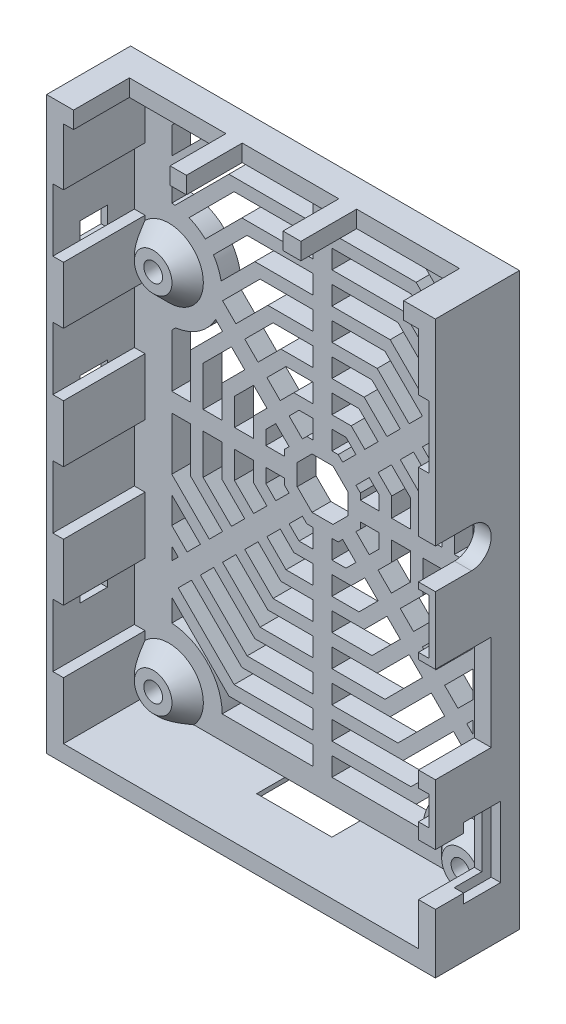
from build123d import *

# Parameters (mm, degrees)
BOSS_EXTRUDE1_DEPTH      = 1.5
BOSS_EXTRUDE1_DEPTH_BACK = 1.5
SKETCH2_W                = 62
SKETCH2_H                = 91
SKETCH2_R                = 1.5
SKETCH3_R                = 3
SKETCH3_R_2              = 1.5
BOSS_EXTRUDE2_DEPTH      = 2.5
SKETCH4_W                = 62
SKETCH4_H                = 91
SKETCH4_W_2              = 56.6
SKETCH4_H_2              = 85.6
BOSS_EXTRUDE3_DEPTH      = 13
CUT_EXTRUDE1_REACH       = 99.223
SKETCH5_W                = 15.4
SKETCH5_H                = 8.9
SKETCH5_W_2              = 16.4
CUT_EXTRUDE2_REACH       = 80.259
SKETCH6_W                = 8.9
SKETCH6_H                = 8.25
SKETCH6_H_2              = 15.25
CUT_EXTRUDE3_DEPTH       = 2
CHAMFER1_SIZE            = 2.5
CUT_EXTRUDE4_REACH       = 96.7
SKETCH8_W                = 12
SKETCH8_H                = 7.5
CHAMFER2_SIZE            = 2
SKETCH12_W               = 5.9
SKETCH12_H               = 11.25
CUT_EXTRUDE7_DEPTH       = 1.5
CHAMFER3_SIZE            = 2.6
CUT_EXTRUDE9_DEPTH       = 3
SKETCH14_W               = 1.7
SKETCH14_H               = 10
SKETCH14_H_2             = 8.725
SKETCH14_H_3             = 4.65
CUT_EXTRUDE10_DEPTH      = 13
CAVITY3_START            = -31
CAVITY3_OUTLINE_W        = 2.690598923
CAVITY3_OUTLINE_H        = 4
CAVITY3_DEPTH            = 1
SKETCH15_W               = 4.4
SKETCH15_H               = 3.090598923
CUT_EXTRUDE11_DEPTH      = 1


# Read off the part's stored shape, not the designer's step: Cavity3
with BuildPart() as part:
    # Sketch2 → Boss-Extrude1 (new, two sides: drawn at the far end of the back side and taken through both)
    with BuildSketch(Plane.XY.offset(-BOSS_EXTRUDE1_DEPTH_BACK)):
        Rectangle(SKETCH2_W, SKETCH2_H)
        with Locations((-24.5, 19)):
            Circle(SKETCH2_R, mode=Mode.SUBTRACT)
        with Locations((-24.5, -39)):
            Circle(SKETCH2_R, mode=Mode.SUBTRACT)
        with Locations((24.5, -39)):
            Circle(SKETCH2_R, mode=Mode.SUBTRACT)
        with Locations((24.5, 19)):
            Circle(SKETCH2_R, mode=Mode.SUBTRACT)
    extrude(amount=BOSS_EXTRUDE1_DEPTH + BOSS_EXTRUDE1_DEPTH_BACK)

    # Sketch3 → Boss-Extrude2 (add)
    # profile 1 of 4: a face of its own
    with BuildSketch(Plane.XY.offset(1.5)):
        with Locations((-24.5, 19)):
            Circle(SKETCH3_R)
        with Locations((-24.5, 19)):
            Circle(SKETCH3_R_2, mode=Mode.SUBTRACT)
    # profile 2 of 4: a face of its own
    with BuildSketch(Plane.XY.offset(1.5)):
        with Locations((24.5, 19)):
            Circle(SKETCH3_R)
        with Locations((24.5, 19)):
            Circle(SKETCH3_R_2, mode=Mode.SUBTRACT)
    # profile 3 of 4: a face of its own
    with BuildSketch(Plane.XY.offset(1.5)):
        with Locations((24.5, -39)):
            Circle(SKETCH3_R)
        with Locations((24.5, -39)):
            Circle(SKETCH3_R_2, mode=Mode.SUBTRACT)
    # profile 4 of 4: a face of its own
    with BuildSketch(Plane.XY.offset(1.5)):
        with Locations((-24.5, -39)):
            Circle(SKETCH3_R)
        with Locations((-24.5, -39)):
            Circle(SKETCH3_R_2, mode=Mode.SUBTRACT)
    extrude(amount=BOSS_EXTRUDE2_DEPTH)

    # Sketch4 → Boss-Extrude3 (add)
    with BuildSketch(Plane.XY.offset(1.5)):
        Rectangle(SKETCH4_W, SKETCH4_H)
        Rectangle(SKETCH4_W_2, SKETCH4_H_2, mode=Mode.SUBTRACT)
    extrude(amount=BOSS_EXTRUDE3_DEPTH)

    # Sketch5 → Cut-Extrude1 (cut, up to next)
    with BuildSketch(Plane(origin=(0, 45.5, 0), x_dir=(1, 0, 0), z_dir=(0, 1, 0)), mode=Mode.PRIVATE) as cut_extrude1_sk1:
        with Locations((-19, -10.05)):
            Rectangle(SKETCH5_W, SKETCH5_H)
    cut_extrude1_tool1 = extrude(cut_extrude1_sk1.sketch, amount=-CUT_EXTRUDE1_REACH, mode=Mode.PRIVATE) & part.part
    # Sketch5 → Cut-Extrude1 (cut, up to next)
    with BuildSketch(Plane(origin=(0, 45.5, 0), x_dir=(1, 0, 0), z_dir=(0, 1, 0)), mode=Mode.PRIVATE) as cut_extrude1_sk2:
        with Locations((-1, -10.05)):
            Rectangle(SKETCH5_W, SKETCH5_H)
    cut_extrude1_tool2 = extrude(cut_extrude1_sk2.sketch, amount=-CUT_EXTRUDE1_REACH, mode=Mode.PRIVATE) & part.part
    # Sketch5 → Cut-Extrude1 (cut, up to next)
    with BuildSketch(Plane(origin=(0, 45.5, 0), x_dir=(1, 0, 0), z_dir=(0, 1, 0)), mode=Mode.PRIVATE) as cut_extrude1_sk3:
        with Locations((17.75, -10.05)):
            Rectangle(SKETCH5_W_2, SKETCH5_H)
    cut_extrude1_tool3 = extrude(cut_extrude1_sk3.sketch, amount=-CUT_EXTRUDE1_REACH, mode=Mode.PRIVATE) & part.part
    add(cut_extrude1_tool1.solids().sort_by_distance((-19, 45.5, 10.05))[0], mode=Mode.SUBTRACT)
    add(cut_extrude1_tool2.solids().sort_by_distance((-1, 45.5, 10.05))[0], mode=Mode.SUBTRACT)
    add(cut_extrude1_tool3.solids().sort_by_distance((17.75, 45.5, 10.05))[0], mode=Mode.SUBTRACT)

    # Sketch6 → Cut-Extrude2 (cut, up to next)
    with BuildSketch(Plane(origin=(31, 0, 0), x_dir=(0, 0, -1), z_dir=(1, 0, 0)), mode=Mode.PRIVATE) as cut_extrude2_sk1:
        with BuildLine():
            Line((-8.75, 14.15), (-14.5, 14.15))
            Line((-14.5, 14.15), (-14.5, 7.85))
            Line((-14.5, 7.85), (-8.75, 7.85))
            ThreePointArc((-8.75, 7.85), (-5.6, 11), (-8.75, 14.15))
        make_face()
    cut_extrude2_tool1 = extrude(cut_extrude2_sk1.sketch, amount=-CUT_EXTRUDE2_REACH, mode=Mode.PRIVATE) & part.part
    # Sketch6 → Cut-Extrude2 (cut, up to next)
    with BuildSketch(Plane(origin=(31, 0, 0), x_dir=(0, 0, -1), z_dir=(1, 0, 0)), mode=Mode.PRIVATE) as cut_extrude2_sk2:
        with Locations((-10.05, -31.9)):
            Rectangle(SKETCH6_W, SKETCH6_H)
    cut_extrude2_tool2 = extrude(cut_extrude2_sk2.sketch, amount=-CUT_EXTRUDE2_REACH, mode=Mode.PRIVATE) & part.part
    # Sketch6 → Cut-Extrude2 (cut, up to next)
    with BuildSketch(Plane(origin=(31, 0, 0), x_dir=(0, 0, -1), z_dir=(1, 0, 0)), mode=Mode.PRIVATE) as cut_extrude2_sk3:
        with Locations((-10.05, -10.5)):
            Rectangle(SKETCH6_W, SKETCH6_H_2)
    cut_extrude2_tool3 = extrude(cut_extrude2_sk3.sketch, amount=-CUT_EXTRUDE2_REACH, mode=Mode.PRIVATE) & part.part
    add(cut_extrude2_tool1.solids().sort_by_distance((31, 11, 10.357945))[0], mode=Mode.SUBTRACT)
    add(cut_extrude2_tool2.solids().sort_by_distance((31, -31.9, 10.05))[0], mode=Mode.SUBTRACT)
    add(cut_extrude2_tool3.solids().sort_by_distance((31, -10.5, 10.05))[0], mode=Mode.SUBTRACT)

    # Sketch7 → Cut-Extrude3 (cut)
    with BuildSketch(Plane(origin=(0, 0, -1.5), x_dir=(-1, 0, 0), z_dir=(0, 0, -1))):
        Polygon((-21.266838493, 19), (-22.883419246, 21.8), (-26.116580754, 21.8), (-27.733161507, 19), (-26.116580754, 16.2), (-22.883419246, 16.2), align=None)
        Polygon((27.733161507, 19), (26.116580754, 21.8), (22.883419246, 21.8), (21.266838493, 19), (22.883419246, 16.2), (26.116580754, 16.2), align=None)
        Polygon((27.733161507, -39), (26.116580754, -36.2), (22.883419246, -36.2), (21.266838493, -39), (22.883419246, -41.8), (26.116580754, -41.8), align=None)
        Polygon((-21.266838493, -39), (-22.883419246, -36.2), (-26.116580754, -36.2), (-27.733161507, -39), (-26.116580754, -41.8), (-22.883419246, -41.8), align=None)
    extrude(amount=-CUT_EXTRUDE3_DEPTH, mode=Mode.SUBTRACT)

    # Chamfer1
    # the kernel refuses this chamfer: 2.5 mm, written as the material it adds along each edge
    with BuildSketch(Plane(origin=(-24.5, 19, 1.5), x_dir=(1, 0, 0), z_dir=(0, -1, 0))) as chamfer1_piece_1_section:
        Polygon((3 + CHAMFER1_SIZE, 0), (3, CHAMFER1_SIZE), (3, 0), align=None)
    chamfer1_piece_1 = revolve(axis=Axis((-24.5, 19, 1.5), (0, 0, 1)), mode=Mode.PRIVATE)
    chamfer1_piece_1 = split(chamfer1_piece_1, bisect_by=Plane(origin=(-28.754569267, 19, 4), z_dir=(0, 0, -1)), keep=Keep.TOP, mode=Mode.PRIVATE)
    add(chamfer1_piece_1)
    with BuildSketch(Plane(origin=(24.5, 19, 1.5), x_dir=(1, 0, 0), z_dir=(0, -1, 0))) as chamfer1_piece_2_section:
        Polygon((3 + CHAMFER1_SIZE, 0), (3, CHAMFER1_SIZE), (3, 0), align=None)
    chamfer1_piece_2 = revolve(axis=Axis((24.5, 19, 1.5), (0, 0, 1)), mode=Mode.PRIVATE)
    chamfer1_piece_2 = split(chamfer1_piece_2, bisect_by=Plane(origin=(20.245430733, 19, 4), z_dir=(0, 0, -1)), keep=Keep.TOP, mode=Mode.PRIVATE)
    add(chamfer1_piece_2)
    with BuildSketch(Plane(origin=(24.5, -39, 1.5), x_dir=(1, 0, 0), z_dir=(0, -1, 0))) as chamfer1_piece_3_section:
        Polygon((3 + CHAMFER1_SIZE, 0), (3, CHAMFER1_SIZE), (3, 0), align=None)
    chamfer1_piece_3 = revolve(axis=Axis((24.5, -39, 1.5), (0, 0, 1)), mode=Mode.PRIVATE)
    chamfer1_piece_3 = split(chamfer1_piece_3, bisect_by=Plane(origin=(20.245430733, -39, 4), z_dir=(0, 0, -1)), keep=Keep.TOP, mode=Mode.PRIVATE)
    add(chamfer1_piece_3)
    with BuildSketch(Plane(origin=(-24.5, -39, 1.5), x_dir=(1, 0, 0), z_dir=(0, -1, 0))) as chamfer1_piece_4_section:
        Polygon((3 + CHAMFER1_SIZE, 0), (3, CHAMFER1_SIZE), (3, 0), align=None)
    chamfer1_piece_4 = revolve(axis=Axis((-24.5, -39, 1.5), (0, 0, 1)), mode=Mode.PRIVATE)
    chamfer1_piece_4 = split(chamfer1_piece_4, bisect_by=Plane(origin=(-28.754569267, -39, 4), z_dir=(0, 0, -1)), keep=Keep.TOP, mode=Mode.PRIVATE)
    add(chamfer1_piece_4)

    # Sketch8 → Cut-Extrude4 (cut, up to next)
    with BuildSketch(Plane(origin=(0, -42.8, 0), x_dir=(1, 0, 0), z_dir=(0, 1, 0)), mode=Mode.PRIVATE) as cut_extrude4_sk1:
        with Locations((0, -2.25)):
            Rectangle(SKETCH8_W, SKETCH8_H)
    cut_extrude4_tool1 = extrude(cut_extrude4_sk1.sketch, amount=-CUT_EXTRUDE4_REACH, mode=Mode.PRIVATE) & part.part
    add(cut_extrude4_tool1.solids().sort_by_distance((0, -42.8, 2.25))[0], mode=Mode.SUBTRACT)

    # Chamfer2
    chamfer2_edges = [part.edges().sort_by_distance(p)[0] for p in [
        (-6, -45.5, 2.25),
        (6, -45.5, 2.25),
        (0, -45.5, 6),
    ]]
    chamfer(chamfer2_edges, length=CHAMFER2_SIZE)

    # Sketch12 → Cut-Extrude7 (cut)
    with BuildSketch(Plane(origin=(31, 0, 0), x_dir=(0, 0, -1), z_dir=(1, 0, 0))):
        with Locations((-7.05, -31.9)):
            Rectangle(SKETCH12_W, SKETCH12_H)
    extrude(amount=-CUT_EXTRUDE7_DEPTH, mode=Mode.SUBTRACT)

    # Chamfer3
    chamfer3_edges = [part.edges().sort_by_distance(p)[0] for p in [
        (19.5, -45.5, -1.5),
        (31, 0, -1.5),
        (0, 45.5, -1.5),
        (-19.5, -45.5, -1.5),
        (-31, 0, -1.5),
    ]]
    chamfer(chamfer3_edges, length=CHAMFER3_SIZE)

    # Sketch13 → Cut-Extrude9 (cut)
    with BuildSketch(Plane.XY.offset(1.5)):
        with BuildLine():
            Line((-16.169047558, 39.035533906), (-1.5, 39.035533906))
            Line((-1.5, 39.035533906), (-1.5, 36.035533906))
            Line((-1.5, 36.035533906), (-14.926406871, 36.035533906))
            Line((-14.926406871, 36.035533906), (-23.518767087, 27.443173691))
            ThreePointArc((-23.518767087, 27.443173691), (-23.776813855, 27.469179523), (-24.035533906, 27.487300587))
            Line((-24.035533906, 27.487300587), (-24.035533906, 31.169047558))
            Line((-24.035533906, 31.169047558), (-16.169047558, 39.035533906))
        make_face()
        Polygon((-5.813708499, 14.035533906), (-1.5, 14.035533906), (-1.5, 11.035533906), (-4.571067812, 11.035533906), (-6.742640687, 8.863961031), (-8.863961031, 10.985281374), align=None)
        Polygon((-7.884776311, 19.035533906), (-1.5, 19.035533906), (-1.5, 16.035533906), (-6.642135624, 16.035533906), (-10.278174593, 12.399494937), (-12.399494937, 14.52081528), align=None)
        Polygon((-9.955844123, 24.035533906), (-1.5, 24.035533906), (-1.5, 21.035533906), (-8.713203436, 21.035533906), (-13.813708499, 15.935028843), (-15.935028843, 18.056349186), align=None)
        with BuildLine():
            Line((-12.026911935, 29.035533906), (-1.5, 29.035533906))
            Line((-1.5, 29.035533906), (-1.5, 26.035533906))
            Line((-1.5, 26.035533906), (-10.784271247, 26.035533906))
            Line((-10.784271247, 26.035533906), (-16.163028634, 20.65677652))
            ThreePointArc((-16.163028634, 20.65677652), (-16.634038342, 22.221280366), (-17.395682807, 23.666763034))
            Line((-17.395682807, 23.666763034), (-12.026911935, 29.035533906))
        make_face()
        Polygon((-3.742640687, 9.035533906), (-1.5, 9.035533906), (-1.5, 6.035533906), (-2.5, 6.035533906), (-3.207106781, 5.328427125), (-5.328427125, 7.449747468), align=None)
        with BuildLine():
            Line((-14.097979746, 34.035533906), (-1.5, 34.035533906))
            Line((-1.5, 34.035533906), (-1.5, 31.035533906))
            Line((-1.5, 31.035533906), (-12.855339059, 31.035533906))
            Line((-12.855339059, 31.035533906), (-18.688207123, 25.202665842))
            ThreePointArc((-18.688207123, 25.202665842), (-19.903933414, 26.150256774), (-21.270799938, 26.862713715))
            Line((-21.270799938, 26.862713715), (-14.097979746, 34.035533906))
        make_face()
        Polygon((-23.24011537, 39.035533906), (-18.997474683, 39.035533906), (-24.035533906, 33.997474683), (-24.035533906, 38.24011537), align=None)
        Polygon((24.035533906, -9.955844123), (24.035533906, -1.5), (21.035533906, -1.5), (21.035533906, -8.713203436), (15.935028843, -13.813708499), (18.056349186, -15.935028843), align=None)
        Polygon((24.035533906, -21.914213562), (24.035533906, -19.855339059), (23.006096654, -20.884776311), align=None)
        Polygon((-24.035533906, -9.955844123), (-24.035533906, -1.5), (-21.035533906, -1.5), (-21.035533906, -8.713203436), (-15.935028843, -13.813708499), (-18.056349186, -15.935028843), align=None)
        with BuildLine():
            Line((-24.035533906, 9.955844123), (-24.035533906, 1.5))
            Line((-24.035533906, 1.5), (-21.035533906, 1.5))
            Line((-21.035533906, 1.5), (-21.035533906, 8.713203436))
            Line((-21.035533906, 8.713203436), (-15.935028843, 13.813708499))
            Line((-15.935028843, 13.813708499), (-17.04254688, 14.921226537))
            ThreePointArc((-17.04254688, 14.921226537), (-19.709764655, 11.978344544), (-23.422851922, 10.568526106))
            Line((-23.422851922, 10.568526106), (-24.035533906, 9.955844123))
        make_face()
        Polygon((-24.035533906, -21.914213562), (-24.035533906, -19.855339059), (-23.006096654, -20.884776311), align=None)
        Polygon((24.035533906, -17.026911935), (24.035533906, -12.784271247), (19.470562748, -17.349242405), (21.591883092, -19.470562748), align=None)
        with BuildLine():
            Line((24.035533906, 9.955844123), (24.035533906, 1.5))
            Line((24.035533906, 1.5), (21.035533906, 1.5))
            Line((21.035533906, 1.5), (21.035533906, 8.713203436))
            Line((21.035533906, 8.713203436), (15.935028843, 13.813708499))
            Line((15.935028843, 13.813708499), (17.04254688, 14.921226537))
            ThreePointArc((17.04254688, 14.921226537), (19.709764655, 11.978344544), (23.422851922, 10.568526106))
            Line((23.422851922, 10.568526106), (24.035533906, 9.955844123))
        make_face()
        with BuildLine():
            Line((24.035533906, 31.169047558), (24.035533906, 27.487300587))
            ThreePointArc((24.035533906, 27.487300587), (23.776813855, 27.469179523), (23.518767087, 27.443173691))
            Line((23.518767087, 27.443173691), (14.926406871, 36.035533906))
            Line((14.926406871, 36.035533906), (1.5, 36.035533906))
            Line((1.5, 36.035533906), (1.5, 39.035533906))
            Line((1.5, 39.035533906), (16.169047558, 39.035533906))
            Line((16.169047558, 39.035533906), (24.035533906, 31.169047558))
        make_face()
        Polygon((-24.035533906, -17.026911935), (-24.035533906, -12.784271247), (-19.470562748, -17.349242405), (-21.591883092, -19.470562748), align=None)
        Polygon((4.035533906, -1.671572875), (4.035533906, 1.671572875), (1.671572875, 4.035533906), (-1.671572875, 4.035533906), (-4.035533906, 1.671572875), (-4.035533906, -1.671572875), (-1.671572875, -4.035533906), (1.671572875, -4.035533906), align=None)
        Polygon((23.24011537, 39.035533906), (18.997474683, 39.035533906), (24.035533906, 33.997474683), (24.035533906, 38.24011537), align=None)
        with BuildLine():
            Line((14.097979746, 34.035533906), (1.5, 34.035533906))
            Line((1.5, 34.035533906), (1.5, 31.035533906))
            Line((1.5, 31.035533906), (12.855339059, 31.035533906))
            Line((12.855339059, 31.035533906), (18.688207123, 25.202665842))
            ThreePointArc((18.688207123, 25.202665842), (19.903933414, 26.150256774), (21.270799938, 26.862713715))
            Line((21.270799938, 26.862713715), (14.097979746, 34.035533906))
        make_face()
        with BuildLine():
            Line((12.026911935, 29.035533906), (1.5, 29.035533906))
            Line((1.5, 29.035533906), (1.5, 26.035533906))
            Line((1.5, 26.035533906), (10.784271247, 26.035533906))
            Line((10.784271247, 26.035533906), (16.163028634, 20.65677652))
            ThreePointArc((16.163028634, 20.65677652), (16.634038342, 22.221280366), (17.395682807, 23.666763034))
            Line((17.395682807, 23.666763034), (12.026911935, 29.035533906))
        make_face()
        Polygon((9.955844123, 24.035533906), (1.5, 24.035533906), (1.5, 21.035533906), (8.713203436, 21.035533906), (13.813708499, 15.935028843), (15.935028843, 18.056349186), align=None)
        Polygon((7.884776311, 19.035533906), (1.5, 19.035533906), (1.5, 16.035533906), (6.642135624, 16.035533906), (10.278174593, 12.399494937), (12.399494937, 14.52081528), align=None)
        Polygon((5.813708499, 14.035533906), (1.5, 14.035533906), (1.5, 11.035533906), (4.571067812, 11.035533906), (6.742640687, 8.863961031), (8.863961031, 10.985281374), align=None)
        Polygon((3.742640687, 9.035533906), (1.5, 9.035533906), (1.5, 6.035533906), (2.5, 6.035533906), (3.207106781, 5.328427125), (5.328427125, 7.449747468), align=None)
        Polygon((19.035533906, 7.884776311), (14.52081528, 12.399494937), (12.399494937, 10.278174593), (16.035533906, 6.642135624), (16.035533906, 1.5), (19.035533906, 1.5), align=None)
        Polygon((14.035533906, 5.813708499), (10.985281374, 8.863961031), (8.863961031, 6.742640687), (11.035533906, 4.571067812), (11.035533906, 1.5), (14.035533906, 1.5), align=None)
        Polygon((9.035533906, 3.742640687), (7.449747468, 5.328427125), (5.328427125, 3.207106781), (6.035533906, 2.5), (6.035533906, 1.5), (9.035533906, 1.5), align=None)
        with BuildLine():
            Line((24.035533906, -30.512699413), (24.035533906, -26.926406871))
            Line((24.035533906, -26.926406871), (14.926406871, -36.035533906))
            Line((14.926406871, -36.035533906), (1.5, -36.035533906))
            Line((1.5, -36.035533906), (1.5, -39.035533906))
            Line((1.5, -39.035533906), (16.000074274, -39.035533906))
            ThreePointArc((16.000074274, -39.035533906), (18.315361197, -33.169027279), (24.035533906, -30.512699413))
        make_face()
        Polygon((19.035533906, -7.884776311), (19.035533906, -1.5), (16.035533906, -1.5), (16.035533906, -6.642135624), (12.399494937, -10.278174593), (14.52081528, -12.399494937), align=None)
        Polygon((14.035533906, -5.813708499), (14.035533906, -1.5), (11.035533906, -1.5), (11.035533906, -4.571067812), (8.863961031, -6.742640687), (10.985281374, -8.863961031), align=None)
        Polygon((9.035533906, -3.742640687), (9.035533906, -1.5), (6.035533906, -1.5), (6.035533906, -2.5), (5.328427125, -3.207106781), (7.449747468, -5.328427125), align=None)
        Polygon((14.097979746, -34.035533906), (23.006096654, -25.127416998), (20.884776311, -23.006096654), (12.855339059, -31.035533906), (1.5, -31.035533906), (1.5, -34.035533906), align=None)
        Polygon((12.026911935, -29.035533906), (19.470562748, -21.591883092), (17.349242405, -19.470562748), (10.784271247, -26.035533906), (1.5, -26.035533906), (1.5, -29.035533906), align=None)
        Polygon((9.955844123, -24.035533906), (15.935028843, -18.056349186), (13.813708499, -15.935028843), (8.713203436, -21.035533906), (1.5, -21.035533906), (1.5, -24.035533906), align=None)
        Polygon((7.884776311, -19.035533906), (12.399494937, -14.52081528), (10.278174593, -12.399494937), (6.642135624, -16.035533906), (1.5, -16.035533906), (1.5, -19.035533906), align=None)
        Polygon((5.813708499, -14.035533906), (8.863961031, -10.985281374), (6.742640687, -8.863961031), (4.571067812, -11.035533906), (1.5, -11.035533906), (1.5, -14.035533906), align=None)
        Polygon((3.742640687, -9.035533906), (5.328427125, -7.449747468), (3.207106781, -5.328427125), (2.5, -6.035533906), (1.5, -6.035533906), (1.5, -9.035533906), align=None)
        with BuildLine():
            Line((-16.000074274, -39.035533906), (-1.5, -39.035533906))
            Line((-1.5, -39.035533906), (-1.5, -36.035533906))
            Line((-1.5, -36.035533906), (-14.926406871, -36.035533906))
            Line((-14.926406871, -36.035533906), (-24.035533906, -26.926406871))
            Line((-24.035533906, -26.926406871), (-24.035533906, -30.512699413))
            ThreePointArc((-24.035533906, -30.512699413), (-18.315361197, -33.169027279), (-16.000074274, -39.035533906))
        make_face()
        Polygon((-14.097979746, -34.035533906), (-1.5, -34.035533906), (-1.5, -31.035533906), (-12.855339059, -31.035533906), (-20.884776311, -23.006096654), (-23.006096654, -25.127416998), align=None)
        Polygon((-12.026911935, -29.035533906), (-1.5, -29.035533906), (-1.5, -26.035533906), (-10.784271247, -26.035533906), (-17.349242405, -19.470562748), (-19.470562748, -21.591883092), align=None)
        Polygon((-9.955844123, -24.035533906), (-1.5, -24.035533906), (-1.5, -21.035533906), (-8.713203436, -21.035533906), (-13.813708499, -15.935028843), (-15.935028843, -18.056349186), align=None)
        Polygon((-7.884776311, -19.035533906), (-1.5, -19.035533906), (-1.5, -16.035533906), (-6.642135624, -16.035533906), (-10.278174593, -12.399494937), (-12.399494937, -14.52081528), align=None)
        Polygon((-5.813708499, -14.035533906), (-1.5, -14.035533906), (-1.5, -11.035533906), (-4.571067812, -11.035533906), (-6.742640687, -8.863961031), (-8.863961031, -10.985281374), align=None)
        Polygon((-3.742640687, -9.035533906), (-1.5, -9.035533906), (-1.5, -6.035533906), (-2.5, -6.035533906), (-3.207106781, -5.328427125), (-5.328427125, -7.449747468), align=None)
        Polygon((-19.035533906, -7.884776311), (-14.52081528, -12.399494937), (-12.399494937, -10.278174593), (-16.035533906, -6.642135624), (-16.035533906, -1.5), (-19.035533906, -1.5), align=None)
        Polygon((-14.035533906, -5.813708499), (-10.985281374, -8.863961031), (-8.863961031, -6.742640687), (-11.035533906, -4.571067812), (-11.035533906, -1.5), (-14.035533906, -1.5), align=None)
        Polygon((-9.035533906, -3.742640687), (-7.449747468, -5.328427125), (-5.328427125, -3.207106781), (-6.035533906, -2.5), (-6.035533906, -1.5), (-9.035533906, -1.5), align=None)
        Polygon((-19.035533906, 7.884776311), (-19.035533906, 1.5), (-16.035533906, 1.5), (-16.035533906, 6.642135624), (-12.399494937, 10.278174593), (-14.52081528, 12.399494937), align=None)
        Polygon((-14.035533906, 5.813708499), (-14.035533906, 1.5), (-11.035533906, 1.5), (-11.035533906, 4.571067812), (-8.863961031, 6.742640687), (-10.985281374, 8.863961031), align=None)
        Polygon((-9.035533906, 3.742640687), (-9.035533906, 1.5), (-6.035533906, 1.5), (-6.035533906, 2.5), (-5.328427125, 3.207106781), (-7.449747468, 5.328427125), align=None)
    extrude(amount=-CUT_EXTRUDE9_DEPTH, mode=Mode.SUBTRACT)

    # Sketch14 → Cut-Extrude10 (cut)
    with BuildSketch(Plane.XY.offset(14.5)):
        with Locations((-29.15, 28.68)):
            Rectangle(SKETCH14_W, SKETCH14_H)
        with Locations((-29.15, 9.56)):
            Rectangle(SKETCH14_W, SKETCH14_H)
        with Locations((-29.15, -9.56)):
            Rectangle(SKETCH14_W, SKETCH14_H)
        with Locations((-29.15, -28.68)):
            Rectangle(SKETCH14_W, SKETCH14_H)
        with Locations((29.15, 28.68)):
            Rectangle(SKETCH14_W, SKETCH14_H)
        with Locations((29.15, 2.4875)):
            Rectangle(SKETCH14_W, SKETCH14_H_2)
        with Locations((29.15, -22.95)):
            Rectangle(SKETCH14_W, SKETCH14_H_3)
    extrude(amount=-CUT_EXTRUDE10_DEPTH, mode=Mode.SUBTRACT)

    # Cavity3 outline → Cavity3 (cut)
    with BuildSketch(Plane.YZ.offset(CAVITY3_START)):
        Polygon((4.809401077, 10), (3.464101615, 10), (0, 12), (-3.464101615, 10), (-4.809401077, 10), (-4.809401077, 6), (-3.464101615, 6), (0, 4), (3.464101615, 6), (4.809401077, 6), align=None)
        with Locations((-24.845299462, 8)):
            Rectangle(CAVITY3_OUTLINE_W, CAVITY3_OUTLINE_H)
        with Locations((24.845299462, 8)):
            Rectangle(CAVITY3_OUTLINE_W, CAVITY3_OUTLINE_H)
        Polygon((-39, 4), (-35.535898385, 6), (-35.535898385, 10), (-39, 12), (-42.464101615, 10), (-42.464101615, 6), align=None)
        Polygon((35.535898385, 10), (35.535898385, 6), (39, 4), (42.464101615, 6), (42.464101615, 10), (39, 12), align=None)
    extrude(amount=CAVITY3_DEPTH, mode=Mode.SUBTRACT)

    # Sketch15 → Cut-Extrude11 (cut)
    with BuildSketch(Plane.ZY.offset(31)):
        Polygon((10.115470054, 42.664101615), (5.884529946, 42.664101615), (3.769059892, 39), (5.884529946, 35.335898385), (10.115470054, 35.335898385), (12.230940108, 39), align=None)
        Polygon((10.2, 3.517691454), (12.230940108, 0), (10.2, -3.517691454), (10.2, -5.009401077), (5.8, -5.009401077), (5.8, -3.517691454), (3.769059892, 0), (5.8, 3.517691454), (5.8, 5.009401077), (10.2, 5.009401077), align=None)
        with Locations((8, -24.845299462)):
            Rectangle(SKETCH15_W, SKETCH15_H)
        with Locations((8, 24.845299462)):
            Rectangle(SKETCH15_W, SKETCH15_H)
        Polygon((12.230940108, -39), (10.115470054, -42.664101615), (5.884529946, -42.664101615), (3.769059892, -39), (5.884529946, -35.335898385), (10.115470054, -35.335898385), align=None)
    extrude(amount=-CUT_EXTRUDE11_DEPTH, mode=Mode.SUBTRACT)


solid = part.part
